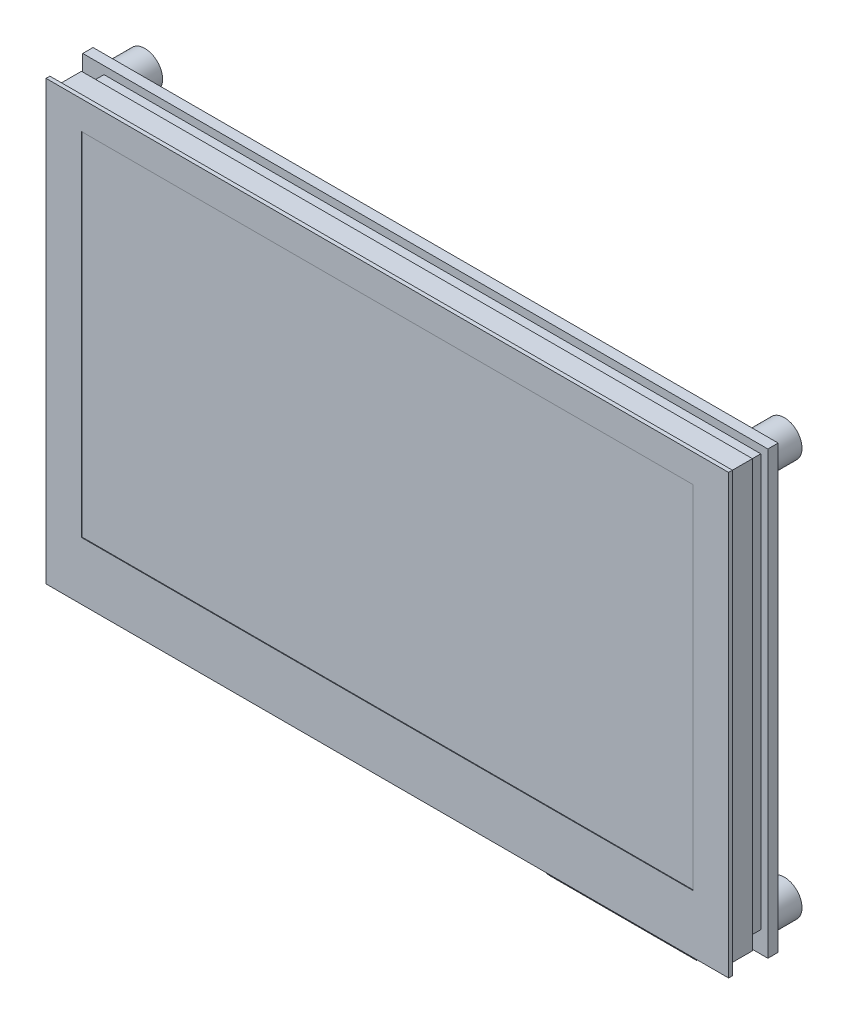
from build123d import *

# Parameters (mm, degrees)
SKETCH1_W                       = 106
SKETCH1_H                       = 68
BOSS_EXTRUDE1_DEPTH             = 0.6
SKETCH2_W                       = 95
SKETCH2_H                       = 54.6
CUT_EXTRUDE1_DEPTH              = 0.1
SKETCH4_W                       = 104.2
SKETCH4_H                       = 66.2
BOSS_EXTRUDE2_DEPTH             = 4
SKETCH5_W                       = 102
SKETCH5_H                       = 64
BOSS_EXTRUDE3_DEPTH             = 2.4
SKETCH6_W                       = 106.4
SKETCH6_H                       = 68.5
BOSS_EXTRUDE4_DEPTH             = 1.6
BOSS_EXTRUDE5_DEPTH             = 2.8
BOSS_EXTRUDE5_DIRECTION_2_REACH = 88.689
FILLET1_R                       = 2
CUT_EXTRUDE2_REACH              = 114.578
SKETCH9_R                       = 2.75
BOSS_EXTRUDE6_DEPTH             = 4.5
SKETCH10_R                      = 1.25
CUT_EXTRUDE3_DEPTH              = 6.1
SKETCH11_W                      = 2.5
SKETCH11_H                      = 22
BOSS_EXTRUDE7_DEPTH             = 5.6
SKETCH12_W                      = 23.5
SKETCH12_H                      = 6
SKETCH12_W_2                    = 6.5
BOSS_EXTRUDE8_DEPTH             = 3


with BuildPart() as part:
    # Sketch1 → Boss-Extrude1 (new body)
    with BuildSketch(Plane.XY):
        Rectangle(SKETCH1_W, SKETCH1_H)
    extrude(amount=BOSS_EXTRUDE1_DEPTH)

    # Sketch2 → Cut-Extrude1 (cut)
    with BuildSketch(Plane.XY.offset(0.6)):
        with Locations((0, 2.3)):
            Rectangle(SKETCH2_W, SKETCH2_H)
    extrude(amount=-CUT_EXTRUDE1_DEPTH, mode=Mode.SUBTRACT)

    # Sketch4 → Boss-Extrude2 (add)
    with BuildSketch(Plane(origin=(0, 0, 0), x_dir=(-1, 0, 0), z_dir=(0, 0, -1))):
        Rectangle(SKETCH4_W, SKETCH4_H)
    extrude(amount=BOSS_EXTRUDE2_DEPTH)

    # Sketch5 → Boss-Extrude3 (add)
    with BuildSketch(Plane(origin=(0, 0, -4), x_dir=(-1, 0, 0), z_dir=(0, 0, -1))):
        Rectangle(SKETCH5_W, SKETCH5_H)
    extrude(amount=BOSS_EXTRUDE3_DEPTH)

    # Sketch6 → Boss-Extrude4 (add)
    with BuildSketch(Plane(origin=(0, 0, -6.4), x_dir=(-1, 0, 0), z_dir=(0, 0, -1))):
        with Locations((1.1, -1.05)):
            Rectangle(SKETCH6_W, SKETCH6_H)
    extrude(amount=BOSS_EXTRUDE4_DEPTH)

    # Sketch7 → Boss-Extrude5 (add)
    with BuildSketch(Plane.XZ.offset(33.1)):
        Polygon((47.5, 0), (42.5, -5), (28.5, -5), (23.5, 0), align=None)
    extrude(amount=BOSS_EXTRUDE5_DEPTH)

    # Boss-Extrude5 direction 2: up to this face of the body (flat: up to its plane)
    boss_extrude5_direction_2_end = Plane(part.part.faces().sort_by_distance((0, -32, -5.2))[0])
    # Sketch7 → Boss-Extrude5 direction 2 (add, up to the picked face)
    with BuildSketch(Plane.XZ.offset(33.1), mode=Mode.PRIVATE) as boss_extrude5_direction_2_sk1:
        Polygon((47.5, 0), (42.5, -5), (28.5, -5), (23.5, 0), align=None)
    boss_extrude5_direction_2_tool1 = split(extrude(boss_extrude5_direction_2_sk1.sketch, amount=-BOSS_EXTRUDE5_DIRECTION_2_REACH, mode=Mode.PRIVATE), bisect_by=boss_extrude5_direction_2_end, keep=Keep.BOTH, mode=Mode.PRIVATE)
    add(boss_extrude5_direction_2_tool1.solids().sort_by(Axis((35.5, -33.1, -2.280702), (0, 1, 0)))[0])

    # Fillet1
    # the kernel refuses this fillet: 2 mm, written as the material it takes off along each edge
    with BuildSketch(Plane(origin=(18.506253911, -35.9, 0), x_dir=(0, 1, 0), z_dir=(1, 0, 0))) as fillet1_piece_1:
        with BuildLine():
            CenterArc((2, -1.997498436), FILLET1_R, 92.865983983, 87.134016017)
            Line((0, -1.997498436), (-0.04, -1.997498436))
            Line((-0.04, -1.997498436), (-0.04, 0))
            Line((-0.04, 0), (0, 0.04))
            ThreePointArc((0, 0.04), (0.95, 0.04), (1.898, 0.039949969))
            Line((1.898, 0.039949969), (1.9, 0))
        make_face()
    extrude(amount=33.987492178, mode=Mode.SUBTRACT)
    with BuildSketch(Plane(origin=(47.5, -35.9, -5), x_dir=(0, 0, 1), z_dir=(-1, 0, 0))) as fillet1_piece_2:
        with BuildLine():
            CenterArc((FILLET1_R, FILLET1_R), FILLET1_R, 180, 90)
            Line((0, FILLET1_R), (-FILLET1_R * 0.02, FILLET1_R))
            Line((-FILLET1_R * 0.02, FILLET1_R), (-FILLET1_R * 0.02, -FILLET1_R * 0.02))
            Line((-FILLET1_R * 0.02, -FILLET1_R * 0.02), (FILLET1_R, -FILLET1_R * 0.02))
            Line((FILLET1_R, -FILLET1_R * 0.02), (FILLET1_R, 0))
        make_face()
    extrude(amount=24, mode=Mode.SUBTRACT)

    # Cut-Extrude2: up to this plane
    cut_extrude2_end = Plane(origin=(28.5, -7.484698656, -5), z_dir=(-0.7071067811865419, 0, -0.7071067811865531))
    # Sketch8 → Cut-Extrude2 (cut, up to the surface)
    with BuildSketch(Plane(origin=(52.1, 0, 0), x_dir=(0, 0, -1), z_dir=(1, 0, 0)), mode=Mode.PRIVATE) as cut_extrude2_sk1:
        with BuildLine():
            Line((4.825635078, -32.015779283), (4, -32.015779283))
            Line((4, -32.015779283), (4, -33.1))
            Line((4, -33.1), (0.255629625, -33.1))
            add(Edge.make_bspline(
                [(0.255629625, -33.1), (-0.100580752, -35.335403533), (4.586512434, -36.596617464), (4.967609775, -32.916750312), (4.825635078, -32.015779283)],
                knots=[0, 0, 0, 0, 0.609319743, 1, 1, 1, 1], degree=3))
        make_face()
    cut_extrude2_tool1 = split(extrude(cut_extrude2_sk1.sketch, amount=-CUT_EXTRUDE2_REACH, mode=Mode.PRIVATE), bisect_by=cut_extrude2_end, keep=Keep.BOTH, mode=Mode.PRIVATE)
    add(cut_extrude2_tool1.solids().sort_by_distance((52.1, -33.994656, -2.685344))[0], mode=Mode.SUBTRACT)

    # Sketch9 → Boss-Extrude6 (add)
    with BuildSketch(Plane(origin=(0, 0, -8), x_dir=(-1, 0, 0), z_dir=(0, 0, -1))):
        with Locations((-48.55, 29.85)):
            Circle(SKETCH9_R)
        with Locations((-48.55, -31.95)):
            Circle(SKETCH9_R)
        with Locations((50.75, 29.85)):
            Circle(SKETCH9_R)
        with Locations((50.75, -31.95)):
            Circle(SKETCH9_R)
        with Locations((-26.25, 23.6)):
            Circle(SKETCH9_R)
        with Locations((-26.25, -25.7)):
            Circle(SKETCH9_R)
        with Locations((31.65, 23.6)):
            Circle(SKETCH9_R)
        with Locations((31.65, -25.7)):
            Circle(SKETCH9_R)
    extrude(amount=BOSS_EXTRUDE6_DEPTH)

    # Sketch10 → Cut-Extrude3 (cut)
    with BuildSketch(Plane(origin=(0, 0, -12.5), x_dir=(-1, 0, 0), z_dir=(0, 0, -1))):
        with Locations((-48.55, 29.85)):
            Circle(SKETCH10_R)
        with Locations((-26.25, 23.6)):
            Circle(SKETCH10_R)
        with Locations((31.65, 23.6)):
            Circle(SKETCH10_R)
        with Locations((50.75, 29.85)):
            Circle(SKETCH10_R)
        with Locations((-26.25, -25.7)):
            Circle(SKETCH10_R)
        with Locations((-48.55, -31.95)):
            Circle(SKETCH10_R)
        with Locations((50.75, -31.95)):
            Circle(SKETCH10_R)
        with Locations((31.65, -25.7)):
            Circle(SKETCH10_R)
    extrude(amount=-CUT_EXTRUDE3_DEPTH, mode=Mode.SUBTRACT)

    # Sketch11 → Boss-Extrude7 (add)
    with BuildSketch(Plane(origin=(0, 0, -8), x_dir=(-1, 0, 0), z_dir=(0, 0, -1))):
        with Locations((50.75, -1.05)):
            Rectangle(SKETCH11_W, SKETCH11_H)
    extrude(amount=BOSS_EXTRUDE7_DEPTH)

    # Sketch12 → Boss-Extrude8 (add)
    with BuildSketch(Plane(origin=(0, 0, -8), x_dir=(-1, 0, 0), z_dir=(0, 0, -1))):
        with Locations((25.15, 7.4)):
            Rectangle(SKETCH12_W, SKETCH12_H)
        with Locations((-32.65, -12.3)):
            Rectangle(SKETCH12_W_2, SKETCH12_H)
    extrude(amount=BOSS_EXTRUDE8_DEPTH)


solid = part.part
